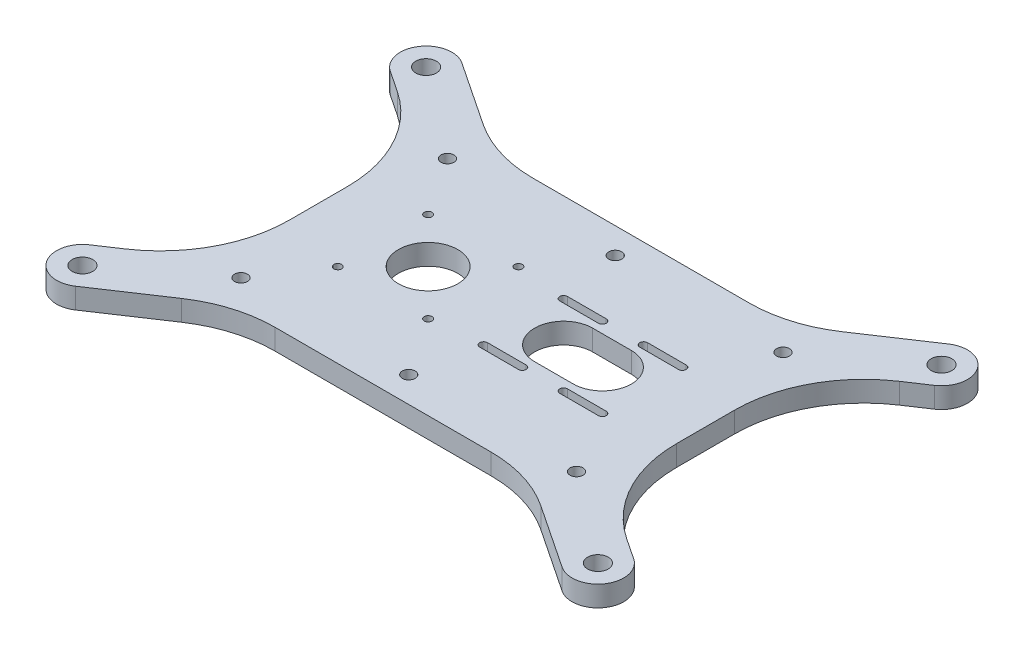
from build123d import *

# Parameters (mm, degrees)
SKETCH1_R           = 4
SKETCH1_R_2         = 11.5
BOSS_EXTRUDE1_DEPTH = 8
SKETCH2_R           = 2.5
SKETCH2_R_2         = 1.5
CUT_EXTRUDE1_DEPTH  = 8
FILLET1_R           = 50
FILLET2_R           = 50
CUT_EXTRUDE2_START  = -8
CUT_EXTRUDE2_DEPTH  = 8


# Read off the part's stored shape, not the designer's step: Cut-Extrude2
with BuildPart() as part:
    # Sketch1 → Boss-Extrude1 (new body)
    with BuildSketch(Plane(origin=(0, 0, 0), x_dir=(1, 0, 0), z_dir=(0, 1, 0))):
        with BuildLine():
            Line((105.393037283, -58.243520604), (75, -37.981495748))
            Line((75, -37.981495748), (75, 37.981495748))
            Line((75, 37.981495748), (105.393037283, 58.243520604))
            ThreePointArc((105.393037283, 58.243520604), (108.166538264, 72.111025509), (94.299033358, 74.88452649))
            Line((94.299033358, 74.88452649), (56.972243623, 50))
            Line((56.972243623, 50), (-56.972243623, 50))
            Line((-56.972243623, 50), (-94.299033358, 74.88452649))
            ThreePointArc((-94.299033358, 74.88452649), (-108.166538264, 72.111025509), (-105.393037283, 58.243520604))
            Line((-105.393037283, 58.243520604), (-75, 37.981495748))
            Line((-75, 37.981495748), (-75, -37.981495748))
            Line((-75, -37.981495748), (-105.393037283, -58.243520604))
            ThreePointArc((-105.393037283, -58.243520604), (-108.166538264, -72.111025509), (-94.299033358, -74.88452649))
            Line((-94.299033358, -74.88452649), (-56.972243623, -50))
            Line((-56.972243623, -50), (56.972243623, -50))
            Line((56.972243623, -50), (94.299033358, -74.88452649))
            ThreePointArc((94.299033358, -74.88452649), (108.166538264, -72.111025509), (105.393037283, -58.243520604))
        make_face()
        with Locations(Location((-99.846035321, -66.564023547, 0), (0, 0, 270))):
            Circle(SKETCH1_R, mode=Mode.SUBTRACT)
        with Locations(Location((-32.5, 0, 0), (0, 0, 270))):
            Circle(SKETCH1_R_2, mode=Mode.SUBTRACT)
        with Locations(Location((99.846035321, -66.564023547, 0), (0, 0, 270))):
            Circle(SKETCH1_R, mode=Mode.SUBTRACT)
        with Locations(Location((-99.846035321, 66.564023547, 0), (0, 0, 270))):
            Circle(SKETCH1_R, mode=Mode.SUBTRACT)
        with Locations(Location((99.846035321, 66.564023547, 0), (0, 0, 270))):
            Circle(SKETCH1_R, mode=Mode.SUBTRACT)
    extrude(amount=BOSS_EXTRUDE1_DEPTH)

    # Sketch2 → Cut-Extrude1 (cut)
    with BuildSketch(Plane(origin=(0, 8, 0), x_dir=(1, 0, 0), z_dir=(0, 1, 0))):
        with Locations(Location((-65, 40, 0), (0, 0, 270))):
            Circle(SKETCH2_R)
        with Locations(Location((65, 40, 0), (0, 0, 270))):
            Circle(SKETCH2_R)
        with Locations(Location((65, -40, 0), (0, 0, 270))):
            Circle(SKETCH2_R)
        with Locations(Location((-65, -40, 0), (0, 0, 270))):
            Circle(SKETCH2_R)
        with Locations(Location((0, -40, 0), (0, 0, 270))):
            Circle(SKETCH2_R)
        with Locations(Location((0, 40, 0), (0, 0, 270))):
            Circle(SKETCH2_R)
        with Locations(Location((-15, 17.5, 0), (0, 0, 270))):
            Circle(SKETCH2_R_2)
        with Locations(Location((-50, 17.5, 0), (0, 0, 270))):
            Circle(SKETCH2_R_2)
        with Locations(Location((-50, -17.5, 0), (0, 0, 270))):
            Circle(SKETCH2_R_2)
        with Locations(Location((-15, -17.5, 0), (0, 0, 270))):
            Circle(SKETCH2_R_2)
    extrude(amount=-CUT_EXTRUDE1_DEPTH, mode=Mode.SUBTRACT)

    # Fillet1
    fillet1_edges = [part.edges().sort_by_distance(p)[0] for p in [
        (-56.972243623, 4, -50),
        (56.972243623, 4, -50),
        (56.972243623, 4, 50),
        (-56.972243623, 4, 50),
    ]]
    fillet(fillet1_edges, radius=FILLET1_R)

    # Fillet2
    fillet2_edges = [part.edges().sort_by_distance(p)[0] for p in [
        (75, 4, -37.981495748),
        (75, 4, 37.981495748),
        (-75, 4, 37.981495748),
        (-75, 4, -37.981495748),
    ]]
    fillet(fillet2_edges, radius=FILLET2_R)

    # Cut-Extrude2 outline → Cut-Extrude2 (cut)
    with BuildSketch(Plane(origin=(0, 8, 0), x_dir=(1, 0, 0), z_dir=(0, 1, 0)).offset(CUT_EXTRUDE2_START)):
        with BuildLine():
            Line((35, 11.25), (20, 11.25))
            ThreePointArc((20, 11.25), (8.75, 0), (20, -11.25))
            Line((20, -11.25), (35, -11.25))
            ThreePointArc((35, -11.25), (46.25, 0), (35, 11.25))
        make_face()
        with BuildLine():
            ThreePointArc((35.5, 17), (34, 15.5), (35.5, 14))
            Line((35.5, 14), (50.5, 14))
            ThreePointArc((50.5, 14), (52, 15.5), (50.5, 17))
            Line((50.5, 17), (35.5, 17))
        make_face()
        with BuildLine():
            ThreePointArc((4.5, 17), (3, 15.5), (4.5, 14))
            Line((4.5, 14), (19.5, 14))
            ThreePointArc((19.5, 14), (21, 15.5), (19.5, 17))
            Line((19.5, 17), (4.5, 17))
        make_face()
        with BuildLine():
            ThreePointArc((4.5, -14), (3, -15.5), (4.5, -17))
            Line((4.5, -17), (19.5, -17))
            ThreePointArc((19.5, -17), (21, -15.5), (19.5, -14))
            Line((19.5, -14), (4.5, -14))
        make_face()
        with BuildLine():
            ThreePointArc((35.5, -14), (34, -15.5), (35.5, -17))
            Line((35.5, -17), (50.5, -17))
            ThreePointArc((50.5, -17), (52, -15.5), (50.5, -14))
            Line((50.5, -14), (35.5, -14))
        make_face()
    extrude(amount=CUT_EXTRUDE2_DEPTH, mode=Mode.SUBTRACT)


solid = part.part
